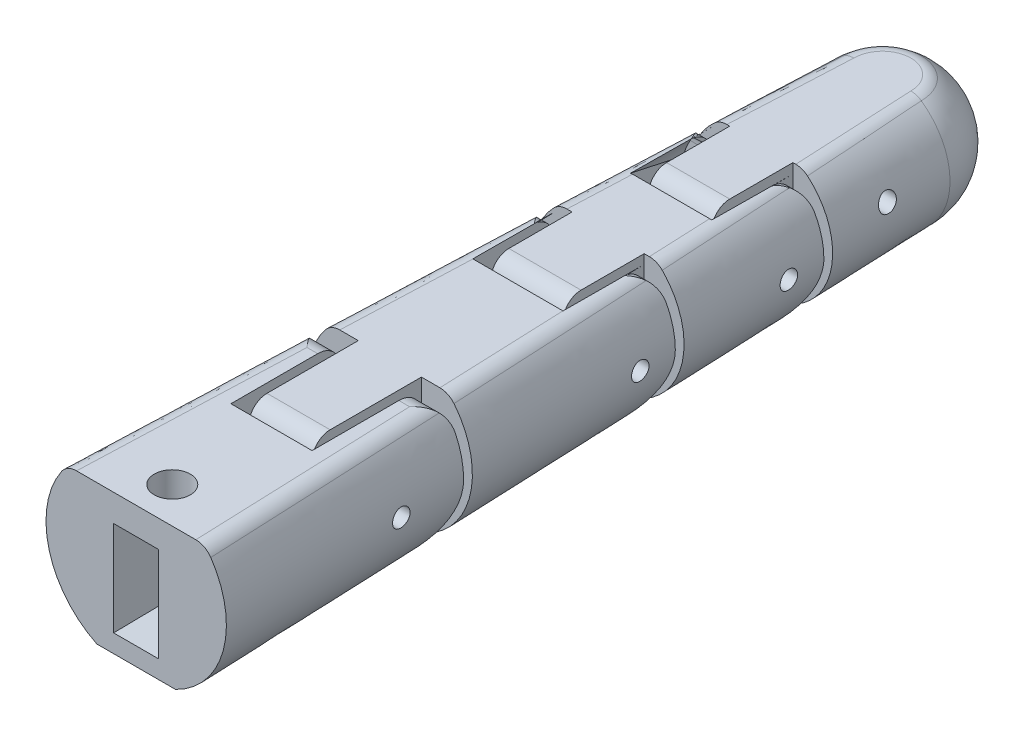
from build123d import *

# Parameters (mm, degrees)
CUT_EXTRUDE_THIN2_DEPTH         = 10
CUT_EXTRUDE_THIN2_DEPTH_BACK    = 65.148345685
SKETCH9_W                       = 82.721688735
SKETCH9_H                       = 5
FILLET1_R                       = 2
CUT_EXTRUDE_THIN1_DEPTH         = 65.148345685
CUT_EXTRUDE_THIN1_DEPTH_BACK    = 65.148345685
REVOLVE1_ANGLE                  = 180
CUT_EXTRUDE29_DEPTH             = 72.49885024
CUT_EXTRUDE29_DEPTH_BACK        = 72.49885024
CUT_EXTRUDE2_DEPTH              = 72.433081926
CUT_EXTRUDE2_DEPTH_BACK         = 72.433081926
FILLET3_R                       = 2
FILLET4_R                       = 2
FILLET5_R                       = 2
CUT_EXTRUDE4_REACH              = 73.433
CUT_EXTRUDE4_DIRECTION_2_REACH  = 73.433
CUT_EXTRUDE6_DEPTH              = 72.433081926
CUT_EXTRUDE6_DEPTH_BACK         = 72.433081926
CUT_EXTRUDE25_START             = -8.449097458
CUT_EXTRUDE25_DEPTH             = 3.449097458
CUT_EXTRUDE25_START_2           = 5
CUT_EXTRUDE25_2_DEPTH           = 3.449097264
CUT_EXTRUDE7_DEPTH              = 72.433081926
CUT_EXTRUDE7_DEPTH_BACK         = 72.433081926
CUT_EXTRUDE8_DEPTH              = 72.433081926
CUT_EXTRUDE8_DEPTH_BACK         = 72.433081926
CUT_EXTRUDE9_REACH              = 73.433
CUT_EXTRUDE9_DIRECTION_2_REACH  = 73.433
CUT_EXTRUDE26_REACH             = 73.433
CUT_EXTRUDE26_DIRECTION_2_REACH = 73.433
CUT_EXTRUDE27_DEPTH             = 72.433081926
CUT_EXTRUDE27_DEPTH_BACK        = 72.433081926
FILLET6_R                       = 5
CUT_EXTRUDE30_DEPTH             = 72.433081926
CUT_EXTRUDE30_DEPTH_BACK        = 72.433081926
SKETCH24_R                      = 1
BOSS_EXTRUDE1_REACH             = 73.433
SKETCH25_R                      = 2.5
SKETCH25_R_2                    = 1
BOSS_EXTRUDE1_DIRECTION_2_REACH = 73.433
SKETCH26_R                      = 0.4
CUT_EXTRUDE31_DEPTH             = 66.693532265
SKETCH26_6_R                    = 0.4
CUT_REVOLVE1_ANGLE              = 90
CUT_EXTRUDE32_REACH             = 73.433
CUT_EXTRUDE32_END_RADIUS        = 2.5
SKETCH30_R                      = 0.4
CUT_EXTRUDE33_DEPTH             = 72.433081926
CUT_EXTRUDE33_DEPTH_BACK        = 72.433081926
SKETCH31_R                      = 1
CUT_EXTRUDE34_START             = 3.524177356
CUT_EXTRUDE34_OUTLINE_R         = 2
CUT_EXTRUDE34_DEPTH             = 2.975822644


# Read off the part's stored shape, not the designer's step: Cut-Extrude25, Cut-Extrude34
with BuildPart() as part:
    # Sketch2 for Loft1 → Loft1 section 0
    with BuildSketch(Plane(origin=(0, 0, -62.721688735), x_dir=(-1, 0, 0), z_dir=(0, 0, -1))):
        with BuildLine():
            Line((-3.741657387, -6.5), (3.741657387, -6.5))
            # circular arc as an exact rational Bezier (weights 1, cos(half-angle), 1)
            Bezier((3.741657387, -6.5), (15.033444858, 0), (3.741657387, 6.5), weights=[1, 0.498887652, 1])
            Line((3.741657387, 6.5), (-3.741657387, 6.5))
            Bezier((-3.741657387, 6.5), (-15.033444858, 0), (-3.741657387, -6.5), weights=[1, 0.498887652, 1])
        make_face()
    # Sketch3 for Loft1 → Loft1 section 1
    with BuildSketch(Plane(origin=(0, 0, 20), x_dir=(-1, 0, 0), z_dir=(0, 0, -1))):
        with BuildLine():
            Line((-4.358898944, -9), (4.358898944, -9))
            Bezier((4.358898944, -9), (22.941573387, 0), (4.358898944, 9), weights=[1, 0.435889894, 1])
            Line((4.358898944, 9), (-4.358898944, 9))
            Bezier((-4.358898944, 9), (-22.941573387, 0), (-4.358898944, -9), weights=[1, 0.435889894, 1])
        make_face()
    loft()

    # Sketch9 → Cut-Extrude-Thin2 (cut, two sides: drawn at the far end of the back side and taken through both)
    with BuildSketch(Plane(origin=(0, 0, 0), x_dir=(0, 0, -1), z_dir=(1, 0, 0)).offset(-CUT_EXTRUDE_THIN2_DEPTH_BACK)):
        with Locations((21.360844368, 9)):
            Rectangle(SKETCH9_W, SKETCH9_H)
    extrude(amount=CUT_EXTRUDE_THIN2_DEPTH + CUT_EXTRUDE_THIN2_DEPTH_BACK, mode=Mode.SUBTRACT)

    # Fillet1
    fillet1_edges = [part.edges().sort_by_distance(p)[0] for p in [
        (5.851592209, 6.5, -21.369440997),
        (-5.851592209, 6.5, -21.369440997),
    ]]
    fillet(fillet1_edges, radius=FILLET1_R)

    # Sketch8 → Cut-Extrude-Thin1 (cut, two sides: drawn at the far end of the back side and taken through both)
    with BuildSketch(Plane(origin=(0, 0, 0), x_dir=(1, 0, 0), z_dir=(0, 1, 0)).offset(-CUT_EXTRUDE_THIN1_DEPTH_BACK)):
        Polygon((-11.232352689, 48.301167679), (-4.5, 48.301167679), (-4.5, 39.301167679), (4.5, 39.301167679), (4.5, 48.301167679), (11.232352689, 48.301167679), (11.232352689, 49.301167679), (3.5, 49.301167679), (3.5, 40.301167679), (-3.5, 40.301167679), (-3.5, 49.301167679), (-11.232352689, 49.301167679), align=None)
        Polygon((-11.285124032, 31.317314287), (-5, 31.317314287), (-5, 22.317314287), (5, 22.317314287), (5, 31.317314287), (11.285124032, 31.317314287), (11.285124032, 32.317314287), (4, 32.317314287), (4, 23.317314287), (-4, 23.317314287), (-4, 32.317314287), (-11.285124032, 32.317314287), align=None)
        Polygon((-11.706212382, 7.12), (-4.5, 7.12), (-4.5, -5), (4.5, -5), (4.5, 7.12), (11.706212382, 7.12), (11.706212382, 8.12), (3.5, 8.12), (3.5, -4), (-3.5, -4), (-3.5, 8.12), (-11.706212382, 8.12), align=None)
    extrude(amount=CUT_EXTRUDE_THIN1_DEPTH + CUT_EXTRUDE_THIN1_DEPTH_BACK, mode=Mode.SUBTRACT)


with BuildPart() as cut_extrude_thin1_piece_1:
    # of the separate pieces the step leaves, piece 1, a body of its own (cut_extrude_thin1_pieces)
    add(part.part.solids().sort_by_distance((-7.150280882, 5.754294678, -7.12))[0])

    # Cut-Extrude26: up to this face of the body (flat: up to its plane)
    cut_extrude26_end = Plane(cut_extrude_thin1_piece_1.part.faces().sort_by_distance((-4.5, -0.853953126, -1.031193401))[0])
    # Sketch14<6> → Cut-Extrude26 (cut, up to the picked face)
    with BuildSketch(Plane(origin=(0, 0, 0), x_dir=(0, 0, -1), z_dir=(1, 0, 0)), mode=Mode.PRIVATE) as cut_extrude26_sk1:
        with BuildLine():
            Line((0, -12.799775453), (0, -4.5))
            ThreePointArc((0, -4.5), (-2.323447288, -3.853776421), (-3.979576166, -2.100707867))
            Line((-3.979576166, -2.100707867), (-8.968633317, -12.799775453))
            Line((-8.968633317, -12.799775453), (0, -12.799775453))
        make_face()
    cut_extrude26_tool1 = split(extrude(cut_extrude26_sk1.sketch, amount=-CUT_EXTRUDE26_REACH, mode=Mode.PRIVATE), bisect_by=cut_extrude26_end, keep=Keep.BOTH, mode=Mode.PRIVATE)
    add(cut_extrude26_tool1.solids().sort_by(Axis((0, -8.687744, 3.59695), (-1, 0, 0)))[0], mode=Mode.SUBTRACT)

    # Cut-Extrude26 direction 2: up to this face of the body (flat: up to its plane)
    cut_extrude26_direction_2_end = Plane(cut_extrude_thin1_piece_1.part.faces().sort_by_distance((4.5, -0.853953126, -1.031193401))[0])
    # Sketch14<6> → Cut-Extrude26 direction 2 (cut, up to the picked face)
    with BuildSketch(Plane(origin=(0, 0, 0), x_dir=(0, 0, -1), z_dir=(1, 0, 0)), mode=Mode.PRIVATE) as cut_extrude26_direction_2_sk1:
        with BuildLine():
            Line((0, -12.799775453), (0, -4.5))
            ThreePointArc((0, -4.5), (-2.323447288, -3.853776421), (-3.979576166, -2.100707867))
            Line((-3.979576166, -2.100707867), (-8.968633317, -12.799775453))
            Line((-8.968633317, -12.799775453), (0, -12.799775453))
        make_face()
    cut_extrude26_direction_2_tool1 = split(extrude(cut_extrude26_direction_2_sk1.sketch, amount=CUT_EXTRUDE26_DIRECTION_2_REACH, mode=Mode.PRIVATE), bisect_by=cut_extrude26_direction_2_end, keep=Keep.BOTH, mode=Mode.PRIVATE)
    add(cut_extrude26_direction_2_tool1.solids().sort_by(Axis((0, -8.687744, 3.59695), (1, 0, 0)))[0], mode=Mode.SUBTRACT)

    # Sketch16<6> → Cut-Extrude27 (cut, two sides: drawn at the far end of the back side and taken through both)
    with BuildSketch(Plane(origin=(0, 0, 0), x_dir=(0, 0, -1), z_dir=(1, 0, 0)).offset(-CUT_EXTRUDE27_DEPTH_BACK)):
        with BuildLine():
            ThreePointArc((4.62, 6.5), (6.387766953, 5.767766953), (7.12, 4))
            Line((7.12, 4), (7.12, 6.5))
            Line((7.12, 6.5), (4.62, 6.5))
        make_face()
        with BuildLine():
            Line((7.12, -7.996833033), (7.12, 0))
            ThreePointArc((7.12, 0), (4.795787458, -5.752057807), (-0.871999932, -8.274818013))
            Line((-0.871999932, -8.274818013), (7.12, -7.996833033))
        make_face()
    extrude(amount=CUT_EXTRUDE27_DEPTH + CUT_EXTRUDE27_DEPTH_BACK, mode=Mode.SUBTRACT)


with BuildPart() as cut_extrude_thin1_piece_2:
    # of the separate pieces the step leaves, piece 2, a body of its own (cut_extrude_thin1_pieces)
    add(part.part.solids().sort_by_distance((-6.046223474, 5.896957524, -31.317314287))[0])

    # Fillet5
    fillet5_edges = [cut_extrude_thin1_piece_2.edges().sort_by_distance(p)[0] for p in [
        (0, 6.5, 4),
    ]]
    fillet(fillet5_edges, radius=FILLET5_R)

    # Cut-Extrude25 outline → Cut-Extrude25 (cut)
    with BuildSketch(Plane(origin=(0, 0, 0), x_dir=(0, 0, -1), z_dir=(1, 0, 0)).offset(CUT_EXTRUDE25_START)):
        with BuildLine():
            ThreePointArc((29.195246991, 6.471268272), (30.713999785, 5.628675572), (31.317314287, 4))
            Line((31.317314287, 4), (31.317314287, 6.462403593))
            Line((31.317314287, 6.462403593), (29.195246991, 6.471268272))
        make_face()
        with BuildLine():
            ThreePointArc((31.317314287, 0), (29.340523545, -4.900617755), (24.516694208, -7.05802976))
            Line((24.516694208, -7.05802976), (31.317314287, -6.805314005))
            Line((31.317314287, -6.805314005), (31.317314287, 0))
        make_face()
    extrude(amount=CUT_EXTRUDE25_DEPTH, mode=Mode.SUBTRACT)

    # Cut-Extrude25 2 outline → Cut-Extrude25 2 (cut)
    with BuildSketch(Plane(origin=(0, 0, 0), x_dir=(0, 0, -1), z_dir=(1, 0, 0)).offset(CUT_EXTRUDE25_START_2)):
        with BuildLine():
            ThreePointArc((29.195246991, 6.471268272), (30.713999785, 5.628675572), (31.317314287, 4))
            Line((31.317314287, 4), (31.317314287, 6.462403593))
            Line((31.317314287, 6.462403593), (29.195246991, 6.471268272))
        make_face()
        with BuildLine():
            ThreePointArc((31.317314287, 0), (29.340523545, -4.900617755), (24.516694208, -7.05802976))
            Line((24.516694208, -7.05802976), (31.317314287, -6.805314005))
            Line((31.317314287, -6.805314005), (31.317314287, 0))
        make_face()
    extrude(amount=CUT_EXTRUDE25_2_DEPTH, mode=Mode.SUBTRACT)

    # Sketch13<5> → Cut-Extrude8 (cut, two sides: drawn at the far end of the back side and taken through both)
    with BuildSketch(Plane(origin=(0, 0, 0), x_dir=(0, 0, -1), z_dir=(1, 0, 0)).offset(-CUT_EXTRUDE8_DEPTH_BACK)):
        with BuildLine():
            Line((8.12, -11.825111773), (8.12, -8.150162417))
            Line((8.12, -8.150162417), (0.274261587, -4.491634511))
            ThreePointArc((0.274261587, -4.491634511), (-3.083490138, -3.277512558), (-4.5, 0))
            Line((-4.5, 0), (-4.5, -11.825111773))
            Line((-4.5, -11.825111773), (8.12, -11.825111773))
        make_face()
    extrude(amount=CUT_EXTRUDE8_DEPTH + CUT_EXTRUDE8_DEPTH_BACK, mode=Mode.SUBTRACT)

    # Cut-Extrude9: up to this face of the body (flat: up to its plane)
    cut_extrude9_end = Plane(cut_extrude_thin1_piece_2.part.faces().sort_by_distance((-5, 0.141181607, -26.482290167))[0])
    # Sketch14<5> → Cut-Extrude9 (cut, up to the picked face)
    with BuildSketch(Plane(origin=(0, 0, 0), x_dir=(0, 0, -1), z_dir=(1, 0, 0)), mode=Mode.PRIVATE) as cut_extrude9_sk1:
        with BuildLine():
            Line((27.317314287, -4.760169045), (27.317314287, -4.5))
            ThreePointArc((27.317314287, -4.5), (24.890715931, -3.789672865), (23.23019698, -1.88294241))
            Line((23.23019698, -1.88294241), (21.569029407, -4.760169045))
            Line((21.569029407, -4.760169045), (27.317314287, -4.760169045))
        make_face()
    cut_extrude9_tool1 = split(extrude(cut_extrude9_sk1.sketch, amount=-CUT_EXTRUDE9_REACH, mode=Mode.PRIVATE), bisect_by=cut_extrude9_end, keep=Keep.BOTH, mode=Mode.PRIVATE)
    add(cut_extrude9_tool1.solids().sort_by(Axis((0, -3.927248, -23.805741), (-1, 0, 0)))[0], mode=Mode.SUBTRACT)

    # Cut-Extrude9 direction 2: up to this face of the body (flat: up to its plane)
    cut_extrude9_direction_2_end = Plane(cut_extrude_thin1_piece_2.part.faces().sort_by_distance((5, 0.141180227, -26.482290094))[0])
    # Sketch14<5> → Cut-Extrude9 direction 2 (cut, up to the picked face)
    with BuildSketch(Plane(origin=(0, 0, 0), x_dir=(0, 0, -1), z_dir=(1, 0, 0)), mode=Mode.PRIVATE) as cut_extrude9_direction_2_sk1:
        with BuildLine():
            Line((27.317314287, -4.760169045), (27.317314287, -4.5))
            ThreePointArc((27.317314287, -4.5), (24.890715931, -3.789672865), (23.23019698, -1.88294241))
            Line((23.23019698, -1.88294241), (21.569029407, -4.760169045))
            Line((21.569029407, -4.760169045), (27.317314287, -4.760169045))
        make_face()
    cut_extrude9_direction_2_tool1 = split(extrude(cut_extrude9_direction_2_sk1.sketch, amount=CUT_EXTRUDE9_DIRECTION_2_REACH, mode=Mode.PRIVATE), bisect_by=cut_extrude9_direction_2_end, keep=Keep.BOTH, mode=Mode.PRIVATE)
    add(cut_extrude9_direction_2_tool1.solids().sort_by(Axis((0, -3.927248, -23.805741), (1, 0, 0)))[0], mode=Mode.SUBTRACT)


with BuildPart() as cut_extrude_thin1_piece_3:
    # of the separate pieces the step leaves, piece 3, a body of its own (cut_extrude_thin1_pieces)
    add(part.part.solids().sort_by_distance((-4.313586755, 6.135386647, -62.721688735))[0])

    # Sketch12 → Revolve1 (revolve)
    with BuildSketch(Plane(origin=(0, 0, -62.721688735), x_dir=(-1, 0, 0), z_dir=(0, 0, -1))):
        with BuildLine():
            Line((0, 6.5), (0, -6.5))
            Line((0, -6.5), (3.741657387, -6.5))
            ThreePointArc((3.741657387, -6.5), (7.492327748, -0.33915323), (4.313618926, 6.135363694))
            ThreePointArc((4.313618926, 6.135363694), (3.765318116, 6.40668479), (3.160718051, 6.5))
            Line((3.160718051, 6.5), (0, 6.5))
        make_face()
    revolve(axis=Axis((0, 6.5, -62.721688735), (0, -1, 0)), revolution_arc=REVOLVE1_ANGLE)

    # Sketch19 → Cut-Extrude29 (cut, two sides: drawn at the far end of the back side and taken through both)
    with BuildSketch(Plane(origin=(0, 0, 0), x_dir=(0, 0, -1), z_dir=(1, 0, 0)).offset(-CUT_EXTRUDE29_DEPTH_BACK)):
        with BuildLine():
            Line((72.575790559, 1), (70.075790559, 1))
            ThreePointArc((70.075790559, 1), (69.689571494, -0.714814088), (68.605496881, -2.098481229))
            ThreePointArc((68.605496881, -2.098481229), (62.832679908, -5.411940777), (56.301167679, -6.694039833))
            Line((56.301167679, -6.694039833), (56.301167679, -8))
            Line((56.301167679, -8), (72.575790559, -8))
            Line((72.575790559, -8), (72.575790559, 1))
        make_face()
    extrude(amount=CUT_EXTRUDE29_DEPTH + CUT_EXTRUDE29_DEPTH_BACK, mode=Mode.SUBTRACT)

    # Sketch13 → Cut-Extrude2 (cut, two sides: drawn at the far end of the back side and taken through both)
    with BuildSketch(Plane(origin=(0, 0, 0), x_dir=(0, 0, -1), z_dir=(1, 0, 0)).offset(-CUT_EXTRUDE2_DEPTH_BACK)):
        with BuildLine():
            Line((49.301167679, -10.580496293), (49.301167679, -6.905592574))
            Line((49.301167679, -6.905592574), (44.135842857, -4.496962053))
            ThreePointArc((44.135842857, -4.496962053), (41.061263228, -3.122982413), (39.801167679, 0))
            Line((39.801167679, 0), (39.801167679, -10.580496293))
            Line((39.801167679, -10.580496293), (49.301167679, -10.580496293))
        make_face()
        with BuildLine():
            Line((8.12, -11.825111773), (8.12, -8.150162417))
            Line((8.12, -8.150162417), (0.274261587, -4.491634511))
            ThreePointArc((0.274261587, -4.491634511), (-3.083490138, -3.277512558), (-4.5, 0))
            Line((-4.5, 0), (-4.5, -11.825111773))
            Line((-4.5, -11.825111773), (8.12, -11.825111773))
        make_face()
        with BuildLine():
            Line((32.317314287, -13.216006642), (32.317314287, -7.401979613))
            Line((32.317314287, -7.401979613), (27.290802889, -4.499921904))
            ThreePointArc((27.290802889, -4.499921904), (24.125974342, -3.172593475), (22.817314287, 0))
            Line((22.817314287, 0), (22.817314287, -13.216006642))
            Line((22.817314287, -13.216006642), (32.317314287, -13.216006642))
        make_face()
    extrude(amount=CUT_EXTRUDE2_DEPTH + CUT_EXTRUDE2_DEPTH_BACK, mode=Mode.SUBTRACT)

    # Fillet3
    fillet3_edges = [cut_extrude_thin1_piece_3.edges().sort_by_distance(p)[0] for p in [
        (0, 6.5, -40.301167679),
    ]]
    fillet(fillet3_edges, radius=FILLET3_R)


with BuildPart() as cut_extrude_thin1_piece_4:
    # of the separate pieces the step leaves, piece 4, a body of its own (cut_extrude_thin1_pieces)
    add(part.part.solids().sort_by_distance((-5.170279675, 6.016957164, -48.301167679))[0])

    # Fillet4
    fillet4_edges = [cut_extrude_thin1_piece_4.edges().sort_by_distance(p)[0] for p in [
        (0, 6.5, -23.317314287),
    ]]
    fillet(fillet4_edges, radius=FILLET4_R)

    # Cut-Extrude4: up to this face of the body (flat: up to its plane)
    cut_extrude4_end = Plane(cut_extrude_thin1_piece_4.part.faces().sort_by_distance((-4.5, -0.123695717, -43.777451051))[0])
    # Sketch14 → Cut-Extrude4 (cut, up to the picked face)
    with BuildSketch(Plane(origin=(0, 0, 0), x_dir=(0, 0, -1), z_dir=(1, 0, 0)), mode=Mode.PRIVATE) as cut_extrude4_sk1:
        Polygon((40.001167679, 0), (38.380310642, -3.475939132), (44.301167679, -3.475939132), (44.301167679, 0), align=None)
    cut_extrude4_tool1 = split(extrude(cut_extrude4_sk1.sketch, amount=-CUT_EXTRUDE4_REACH, mode=Mode.PRIVATE), bisect_by=cut_extrude4_end, keep=Keep.BOTH, mode=Mode.PRIVATE)
    add(cut_extrude4_tool1.solids().sort_by(Axis((0, -1.829841, -41.724533), (-1, 0, 0)))[0], mode=Mode.SUBTRACT)

    # Cut-Extrude4 direction 2: up to this face of the body (flat: up to its plane)
    cut_extrude4_direction_2_end = Plane(cut_extrude_thin1_piece_4.part.faces().sort_by_distance((4.5, -0.123701148, -43.777451031))[0])
    # Sketch14 → Cut-Extrude4 direction 2 (cut, up to the picked face)
    with BuildSketch(Plane(origin=(0, 0, 0), x_dir=(0, 0, -1), z_dir=(1, 0, 0)), mode=Mode.PRIVATE) as cut_extrude4_direction_2_sk1:
        Polygon((40.001167679, 0), (38.380310642, -3.475939132), (44.301167679, -3.475939132), (44.301167679, 0), align=None)
    cut_extrude4_direction_2_tool1 = split(extrude(cut_extrude4_direction_2_sk1.sketch, amount=CUT_EXTRUDE4_DIRECTION_2_REACH, mode=Mode.PRIVATE), bisect_by=cut_extrude4_direction_2_end, keep=Keep.BOTH, mode=Mode.PRIVATE)
    add(cut_extrude4_direction_2_tool1.solids().sort_by(Axis((0, -1.829841, -41.724533), (1, 0, 0)))[0], mode=Mode.SUBTRACT)

    # Sketch16 → Cut-Extrude6 (cut, two sides: drawn at the far end of the back side and taken through both)
    with BuildSketch(Plane(origin=(0, 0, 0), x_dir=(0, 0, -1), z_dir=(1, 0, 0)).offset(-CUT_EXTRUDE6_DEPTH_BACK)):
        with BuildLine():
            ThreePointArc((41.772648874, -6.771109726), (46.403215507, -4.702910926), (48.301167679, 0))
            Line((48.301167679, 0), (48.301167679, -6.5328645))
            Line((48.301167679, -6.5328645), (41.772648874, -6.771109726))
        make_face()
        with BuildLine():
            ThreePointArc((46.000929263, 6.423256282), (47.638203873, 5.626920375), (48.301167679, 3.93125))
            Line((48.301167679, 3.93125), (48.301167679, 6.396907756))
            Line((48.301167679, 6.396907756), (46.000929263, 6.423256282))
        make_face()
    extrude(amount=CUT_EXTRUDE6_DEPTH + CUT_EXTRUDE6_DEPTH_BACK, mode=Mode.SUBTRACT)

    # Sketch13<4> → Cut-Extrude7 (cut, two sides: drawn at the far end of the back side and taken through both)
    with BuildSketch(Plane(origin=(0, 0, 0), x_dir=(0, 0, -1), z_dir=(1, 0, 0)).offset(-CUT_EXTRUDE7_DEPTH_BACK)):
        with BuildLine():
            Line((32.317314287, -13.216006642), (32.317314287, -7.401979613))
            Line((32.317314287, -7.401979613), (27.290802889, -4.499921904))
            ThreePointArc((27.290802889, -4.499921904), (24.125974342, -3.172593475), (22.817314287, 0))
            Line((22.817314287, 0), (22.817314287, -13.216006642))
            Line((22.817314287, -13.216006642), (32.317314287, -13.216006642))
        make_face()
    extrude(amount=CUT_EXTRUDE7_DEPTH + CUT_EXTRUDE7_DEPTH_BACK, mode=Mode.SUBTRACT)


with BuildPart() as cut_loft4_tool:
    # Sketch22 → Cut-Loft4 section 0
    with BuildSketch(Plane(origin=(0, 0, 20), x_dir=(-1, 0, 0), z_dir=(0, 0, -1))):
        with BuildLine():
            Line((2.5, 3.5), (-2.5, 3.5))
            Line((-2.5, 3.5), (-2.5, -3.5))
            Line((-2.5, -3.5), (-2.5, -7))
            Line((-2.5, -7), (2.5, -7))
            Line((2.5, -7), (2.5, -3.5))
            Line((2.5, -3.5), (2.5, 3.5))
        make_face()
    # Sketch23 → Cut-Loft4 section 1
    with BuildSketch(Plane(origin=(0, 0, -62.721688735), x_dir=(-1, 0, 0), z_dir=(0, 0, -1))):
        with BuildLine():
            Line((-2, 4.5), (2, 4.5))
            Line((2, 4.5), (2, -4.5))
            Line((2, -4.5), (2, -5.177588955))
            Line((2, -5.177588955), (-2, -5.177588955))
            Line((-2, -5.177588955), (-2, -4.5))
            Line((-2, -4.5), (-2, 4.5))
        make_face()
    loft()


with BuildPart() as cut_extrude_thin1_piece_1_1:
    add(cut_extrude_thin1_piece_1.part)

    # Cut-Loft4: cut by cut_loft4_tool
    add(cut_loft4_tool.part, mode=Mode.SUBTRACT)


with BuildPart() as cut_extrude_thin1_piece_2_1:
    add(cut_extrude_thin1_piece_2.part)

    # Cut-Loft4: cut by cut_loft4_tool
    add(cut_loft4_tool.part, mode=Mode.SUBTRACT)


with BuildPart() as cut_extrude_thin1_piece_3_1:
    add(cut_extrude_thin1_piece_3.part)

    # Cut-Loft4: cut by cut_loft4_tool
    add(cut_loft4_tool.part, mode=Mode.SUBTRACT)

    # Fillet6
    # the kernel refuses this fillet: 5 mm, written as the material it adds along each edge
    with BuildSketch(Plane(origin=(14.652022426, 4.5, -62.721688735), x_dir=(0, -0.012087844852107133, 0.9999269393344853), z_dir=(-1, 0, 0))) as fillet6_piece_1_section:
        with BuildLine():
            CenterArc((FILLET6_R * 1.01216179407, -FILLET6_R), FILLET6_R, 90, 90.692599361)
            Line((FILLET6_R * 0.0122348547319, -FILLET6_R * 1.01208784485), (0, 0))
            Line((0, 0), (FILLET6_R * 1.01216179407, 0))
        make_face()
    fillet6_piece_1 = extrude(amount=29.304044852, mode=Mode.PRIVATE)
    fillet6_piece_1 = split(fillet6_piece_1, bisect_by=Plane(origin=(2.00688271, 3.340865007, -61.582989931), z_dir=(-0.9999817333322474, 0, 0.0060442536209227415)), keep=Keep.TOP, mode=Mode.PRIVATE)
    fillet6_piece_1 = split(fillet6_piece_1, bisect_by=Plane(origin=(-2.00688271, 3.340865007, -61.582989931), z_dir=(0.9999817333322474, 0, 0.006044253620922747)), keep=Keep.TOP, mode=Mode.PRIVATE)
    add(fillet6_piece_1)
    with BuildSketch(Plane(origin=(-14.227650167, -5.177588955, -62.721688735), x_dir=(0, -0.02202528721491575, 0.9997574139375515), z_dir=(1, 0, 0))) as fillet6_piece_2_section:
        with BuildLine():
            CenterArc((FILLET6_R * 0.978212013386, -FILLET6_R), FILLET6_R, 90, 88.737941946)
            Line((-FILLET6_R * 0.0215454005519, -FILLET6_R * 0.977974712785), (0, 0))
            Line((0, 0), (FILLET6_R * 0.978212013386, 0))
        make_face()
    fillet6_piece_2 = extrude(amount=28.455300335, mode=Mode.PRIVATE)
    fillet6_piece_2 = split(fillet6_piece_2, bisect_by=Plane(origin=(2.006621804, -4.099408356, -61.626155136), z_dir=(-0.9999817333322474, 0, 0.0060442536209227415)), keep=Keep.TOP, mode=Mode.PRIVATE)
    fillet6_piece_2 = split(fillet6_piece_2, bisect_by=Plane(origin=(-2.006621804, -4.099408356, -61.626155136), z_dir=(0.9999817333322474, 0, 0.006044253620922747)), keep=Keep.TOP, mode=Mode.PRIVATE)
    add(fillet6_piece_2)


with BuildPart() as cut_extrude_thin1_piece_4_1:
    add(cut_extrude_thin1_piece_4.part)

    # Cut-Loft4: cut by cut_loft4_tool
    add(cut_loft4_tool.part, mode=Mode.SUBTRACT)


with BuildPart() as cut_extrude30_tool:
    # Sketch24 → Cut-Extrude30 (new, two sides: drawn at the far end of the back side and taken through both)
    with BuildSketch(Plane(origin=(0, 0, 0), x_dir=(0, 0, -1), z_dir=(1, 0, 0)).offset(-CUT_EXTRUDE30_DEPTH_BACK)):
        with Locations((44.301167679, 0)):
            Circle(SKETCH24_R)
        with Locations((27.317314287, 0)):
            Circle(SKETCH24_R)
        Circle(SKETCH24_R)
    extrude(amount=CUT_EXTRUDE30_DEPTH + CUT_EXTRUDE30_DEPTH_BACK)


with BuildPart() as cut_extrude_thin1_piece_1_2:
    add(cut_extrude_thin1_piece_1_1.part)

    # Cut-Extrude30: cut by cut_extrude30_tool
    add(cut_extrude30_tool.part, mode=Mode.SUBTRACT)

    # Cut-Extrude34 outline → Cut-Extrude34 (cut)
    with BuildSketch(Plane(origin=(0, 0, 0), x_dir=(1, 0, 0), z_dir=(0, 1, 0)).offset(CUT_EXTRUDE34_START)):
        with Locations((0, -16)):
            Circle(CUT_EXTRUDE34_OUTLINE_R)
    extrude(amount=CUT_EXTRUDE34_DEPTH, mode=Mode.SUBTRACT)


with BuildPart() as cut_extrude_thin1_piece_2_2:
    add(cut_extrude_thin1_piece_2_1.part)

    # Cut-Extrude30: cut by cut_extrude30_tool
    add(cut_extrude30_tool.part, mode=Mode.SUBTRACT)


with BuildPart() as cut_extrude_thin1_piece_3_2:
    add(cut_extrude_thin1_piece_3_1.part)

    # Cut-Extrude30: cut by cut_extrude30_tool
    add(cut_extrude30_tool.part, mode=Mode.SUBTRACT)

    # Boss-Extrude1: up to this plane
    boss_extrude1_end = Plane(origin=(2.5, 3.5, 20), z_dir=(0.9999817333322475, 0, -0.006044253620922734))
    # Sketch25 → Boss-Extrude1 (add, up to the surface)
    with BuildSketch(Plane(origin=(0, 0, 0), x_dir=(0, 0, -1), z_dir=(1, 0, 0)), mode=Mode.PRIVATE) as boss_extrude1_sk1:
        with Locations(Location((44.301167679, 0, 0), (0, 0, 180))):
            Circle(SKETCH25_R)
        with Locations((44.301167679, 0)):
            Circle(SKETCH25_R_2, mode=Mode.SUBTRACT)
    boss_extrude1_tool1 = split(extrude(boss_extrude1_sk1.sketch, amount=BOSS_EXTRUDE1_REACH, mode=Mode.PRIVATE), bisect_by=boss_extrude1_end, keep=Keep.BOTH, mode=Mode.PRIVATE)
    add(boss_extrude1_tool1.solids().sort_by_distance((0, 0, -46.730457))[0])

    # Boss-Extrude1 direction 2: up to this plane
    boss_extrude1_direction_2_end = Plane(origin=(-2.5, -7, 20), z_dir=(-0.9999817333322475, 0, -0.00604425362092275))
    # Sketch25 → Boss-Extrude1 direction 2 (add, up to the surface)
    with BuildSketch(Plane(origin=(0, 0, 0), x_dir=(0, 0, -1), z_dir=(1, 0, 0)), mode=Mode.PRIVATE) as boss_extrude1_direction_2_sk1:
        with Locations(Location((44.301167679, 0, 0), (0, 0, 180))):
            Circle(SKETCH25_R)
        with Locations((44.301167679, 0)):
            Circle(SKETCH25_R_2, mode=Mode.SUBTRACT)
    boss_extrude1_direction_2_tool1 = split(extrude(boss_extrude1_direction_2_sk1.sketch, amount=-BOSS_EXTRUDE1_DIRECTION_2_REACH, mode=Mode.PRIVATE), bisect_by=boss_extrude1_direction_2_end, keep=Keep.BOTH, mode=Mode.PRIVATE)
    add(boss_extrude1_direction_2_tool1.solids().sort_by_distance((0, 0, -46.730457))[0])

    # Sketch26 → Cut-Extrude31 (cut, through all)
    with BuildSketch(Plane(origin=(0, 0, -44.301167679), x_dir=(-1, 0, 0), z_dir=(0, 0, -1))):
        with Locations((0, -1.75)):
            Circle(SKETCH26_R)
    extrude(amount=-CUT_EXTRUDE31_DEPTH, mode=Mode.SUBTRACT)

    # Sketch26<6> → Cut-Revolve1 (revolve, cut)
    with BuildSketch(Plane(origin=(0, 0, -44.301167679), x_dir=(-1, 0, 0), z_dir=(0, 0, -1))):
        with Locations((0, -1.75)):
            Circle(SKETCH26_6_R)
    revolve(axis=Axis((-53.527625007, 0, -44.301167679), (1, 0, 0)), revolution_arc=CUT_REVOLVE1_ANGLE, mode=Mode.SUBTRACT)

    # Cut-Extrude32: up to this cylinder (the profile starts inside it)
    cut_extrude32_end = Plane(origin=(0, 0, -44.301167679), z_dir=(-1, 0, 0)) * Cylinder(CUT_EXTRUDE32_END_RADIUS, 152.866, mode=Mode.PRIVATE)
    # Sketch30 → Cut-Extrude32 (cut, up to the surface)
    with BuildSketch(Plane(origin=(0, 0, 0), x_dir=(1, 0, 0), z_dir=(0, 1, 0)), mode=Mode.PRIVATE) as cut_extrude32_sk1:
        with Locations(Location((0, 46.051167679, 0), (0, 0, 90))):
            Circle(SKETCH30_R)
    cut_extrude32_tool1 = extrude(cut_extrude32_sk1.sketch, amount=CUT_EXTRUDE32_REACH, mode=Mode.PRIVATE) & cut_extrude32_end
    add(cut_extrude32_tool1.solids().sort_by_distance((0, 0, -46.051168))[0], mode=Mode.SUBTRACT)

    # Sketch31 → Cut-Extrude33 (cut, two sides: drawn at the far end of the back side and taken through both)
    with BuildSketch(Plane(origin=(0, 0, 0), x_dir=(0, 0, -1), z_dir=(1, 0, 0)).offset(-CUT_EXTRUDE33_DEPTH_BACK)):
        with Locations((55.721688735, 1.5)):
            Circle(SKETCH31_R)
    extrude(amount=CUT_EXTRUDE33_DEPTH + CUT_EXTRUDE33_DEPTH_BACK, mode=Mode.SUBTRACT)


with BuildPart() as cut_extrude_thin1_piece_4_2:
    add(cut_extrude_thin1_piece_4_1.part)

    # Cut-Extrude30: cut by cut_extrude30_tool
    add(cut_extrude30_tool.part, mode=Mode.SUBTRACT)


solid = Compound([cut_extrude_thin1_piece_1_2.part, cut_extrude_thin1_piece_2_2.part, cut_extrude_thin1_piece_3_2.part, cut_extrude_thin1_piece_4_2.part])
